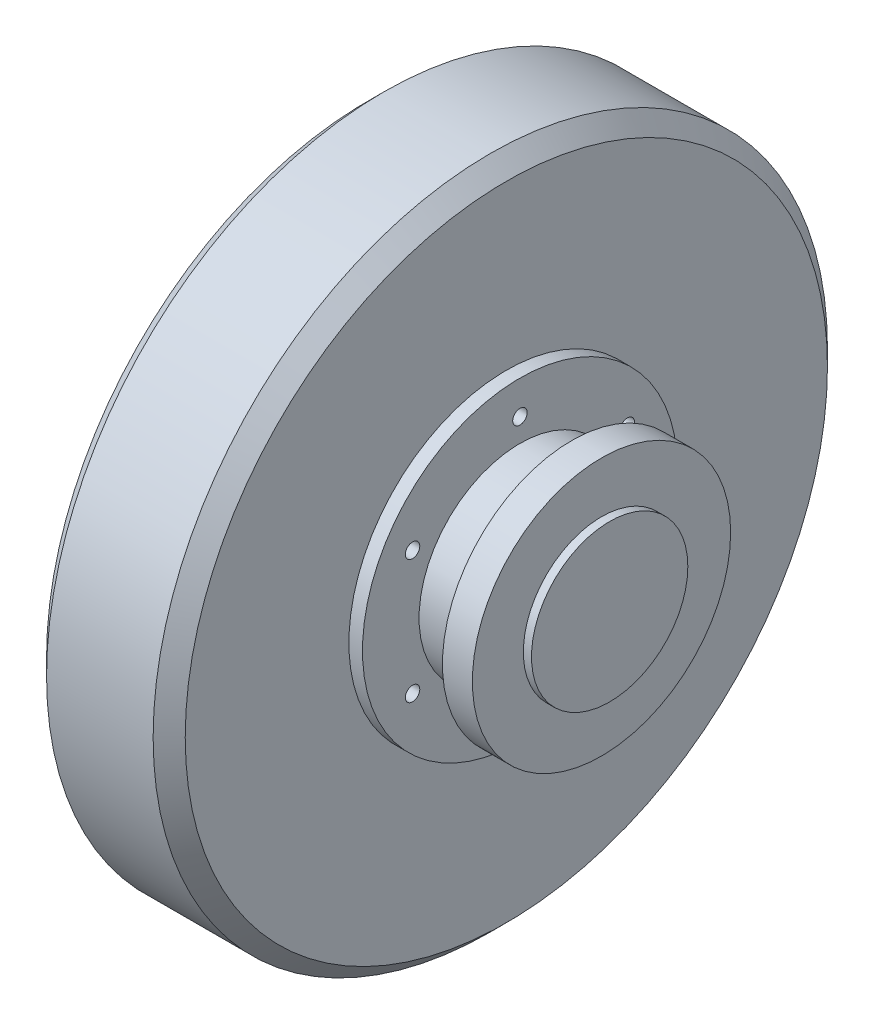
from build123d import *

# Parameters (mm, degrees)
SKETCH1_3_W        = 13.97
SKETCH1_3_H        = 23.8125
SKETCH3_R          = 3.3734375
CUT_EXTRUDE1_DEPTH = 11.43
SKETCH5_R          = 3.3734375
CUT_EXTRUDE2_DEPTH = 12.7


with BuildPart() as part:
    # Sketch1 → Revolve1 (revolve)
    with BuildSketch(Plane(origin=(0, 0, 0), x_dir=(-1, 0, 0), z_dir=(0, 1, 0))):
        Polygon((6.35, 73.550123262), (0, 73.550123262), (0, 47.117), (-20.32, 47.117), (-20.32, 36.5125), (-41.91, 36.5125), (-41.91, 0), (90.17, 0), (90.17, 24.13), (83.82, 24.13), (83.82, 14.9987), (71.12, 14.9987), (71.12, 149.987), (63.627, 157.48), (13.843, 157.48), (6.35, 149.987), align=None)
    revolve(axis=Axis((0, 0, 0), (-1, 0, 0)))

    # Sketch3 → Cut-Extrude1 (cut)
    with BuildSketch(Plane(origin=(-71.12, 0, 0), x_dir=(0, -1, 0), z_dir=(-1, 0, 0))):
        with Locations((-22.394618112, 30.823547486)):
            Circle(SKETCH3_R)
        with Locations((22.394618112, 30.823547486)):
            Circle(SKETCH3_R)
        with Locations((36.235253271, -11.773547486)):
            Circle(SKETCH3_R)
        with Locations((0, -38.1)):
            Circle(SKETCH3_R)
        with Locations((-36.235253271, -11.773547486)):
            Circle(SKETCH3_R)
    extrude(amount=-CUT_EXTRUDE1_DEPTH, mode=Mode.SUBTRACT)

    # Sketch5 → Cut-Extrude2 (cut)
    with BuildSketch(Plane.YZ):
        with Locations((28.956, 50.153263184)):
            Circle(SKETCH5_R)
        with Locations((-28.956, 50.153263184)):
            Circle(SKETCH5_R)
        with Locations((-57.912, 0)):
            Circle(SKETCH5_R)
        with Locations((-28.956, -50.153263184)):
            Circle(SKETCH5_R)
        with Locations((28.956, -50.153263184)):
            Circle(SKETCH5_R)
        with Locations((57.912, 0)):
            Circle(SKETCH5_R)
    extrude(amount=-CUT_EXTRUDE2_DEPTH, mode=Mode.SUBTRACT)


with BuildPart() as body_2:
    # Sketch1<3> → Revolve2 (revolve)
    with BuildSketch(Plane(origin=(0, 0, 0), x_dir=(-1, 0, 0), z_dir=(0, 1, 0))):
        with Locations((-31.115, 48.41875)):
            Rectangle(SKETCH1_3_W, SKETCH1_3_H)
    revolve(axis=Axis((0, 0, 0), (-1, 0, 0)))


solid = Compound([part.part, body_2.part])
